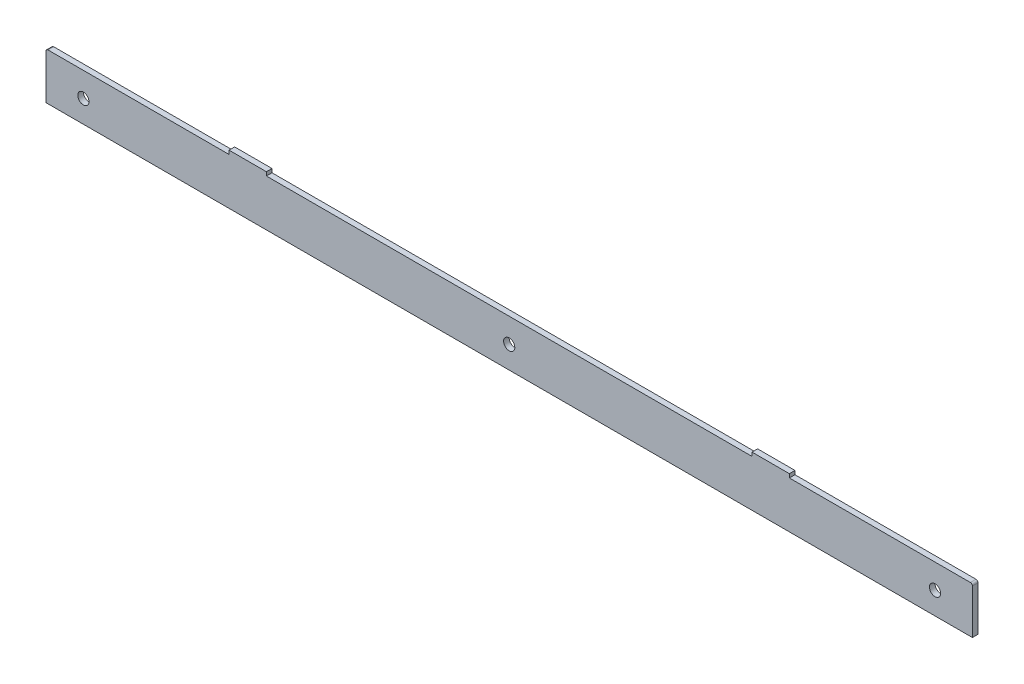
from build123d import *

# Parameters (mm, degrees)
SM_BASE_FLANGE_1_DEPTH = 3
SKETCH_4_W             = 20
SKETCH_4_H             = 3
EXTRUDE_1_DEPTH        = 2
SKETCH_5_R             = 3
CUT_EXTRUDE_1_DEPTH    = 10


# Sheet-metal steps are written as plain solids
with BuildPart() as part:
    # Sketch 1 → Базовая кромка1 (new body)
    with BuildSketch(Plane.XY):
        with BuildLine():
            Line((-52.715343227, 26.180564784), (441.084656773, 26.180564784))
            ThreePointArc((441.084656773, 26.180564784), (441.862474232, 25.858382243), (442.184656773, 25.080564784))
            Line((442.184656773, 25.080564784), (442.184656773, 1.180564784))
            Line((442.184656773, 1.180564784), (-53.815343227, 1.180564784))
            Line((-53.815343227, 1.180564784), (-53.815343227, 25.080564784))
            ThreePointArc((-53.815343227, 25.080564784), (-53.493160687, 25.858382243), (-52.715343227, 26.180564784))
        make_face()
    extrude(amount=-SM_BASE_FLANGE_1_DEPTH)

    # Эскиз4 → Бобышка-Вытянуть1 (add)
    with BuildSketch(Plane(origin=(0, 26.180564784, 0), x_dir=(1, 0, 0), z_dir=(0, 1, 0))):
        with Locations((54.184656773, 1.5)):
            Rectangle(SKETCH_4_W, SKETCH_4_H)
        with Locations((334.184656773, 1.5)):
            Rectangle(SKETCH_4_W, SKETCH_4_H)
    extrude(amount=EXTRUDE_1_DEPTH)

    # Эскиз5 → Вырез-Вытянуть1 (cut)
    with BuildSketch(Plane(origin=(0, 0, -3), x_dir=(-1, 0, 0), z_dir=(0, 0, -1))):
        with Locations((-422.184656773, 13.130564784)):
            Circle(SKETCH_5_R)
        with Locations((-194.184656773, 13.130564784)):
            Circle(SKETCH_5_R)
        with Locations((33.815343227, 13.130564784)):
            Circle(SKETCH_5_R)
    extrude(amount=-CUT_EXTRUDE_1_DEPTH, mode=Mode.SUBTRACT)


solid = part.part
